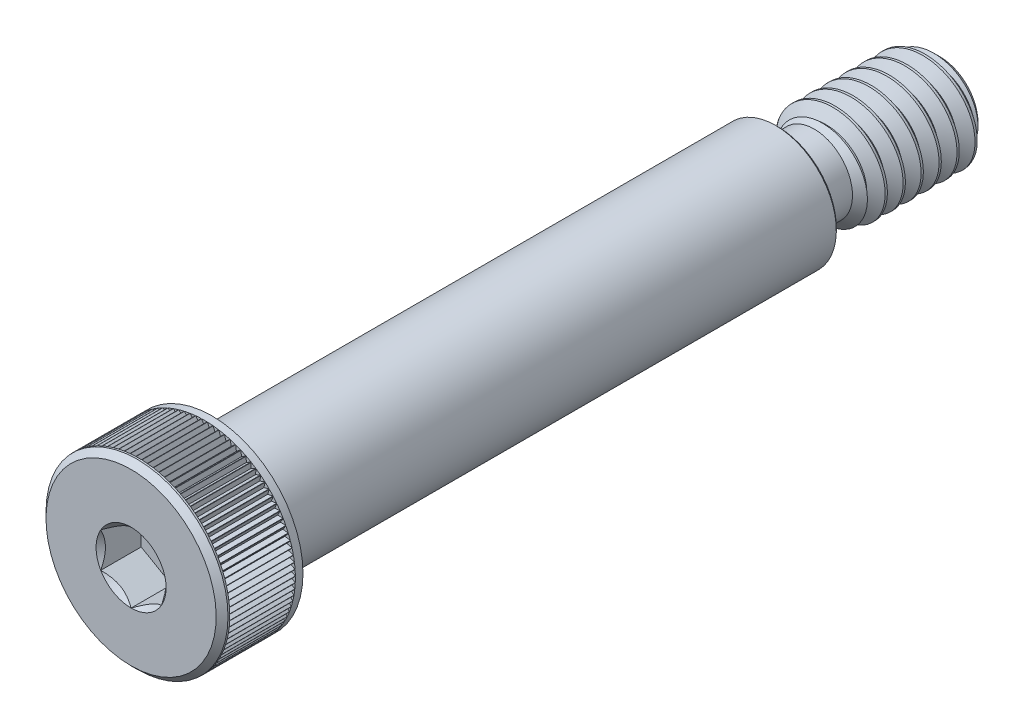
from build123d import *

# Parameters (mm, degrees)
CHAMFER1_SIZE      = 0.993775
CHAMFER2_SIZE      = 0.46434375
CHAMFER3_SIZE      = 0.2032
CUT_EXTRUDE5_DEPTH = 2.575123438
CIRPATTERN1_COUNT  = 99
CUT_EXTRUDE2_DEPTH = 3.175
CUT_SWEEP1_PITCH   = 1.411111111


with BuildPart() as part:
    # Sketch1 → Revolve1 (revolve)
    with BuildSketch(Plane(origin=(0, 0, 0), x_dir=(0, 0, -1), z_dir=(1, 0, 0))):
        Polygon((0, 7.14375), (6.35, 7.14375), (6.35, 4.7625), (50.8, 4.7625), (50.8, 3.9751), (63.5, 3.9751), (63.5, 0), (0, 0), align=None)
    revolve(axis=Axis((0, 0, -63.5), (0, 0, 1)))

    # Sketch5 → Cut-Revolve1 (revolve, cut)
    with BuildSketch(Plane(origin=(0, 0, 0), x_dir=(0, 0, -1), z_dir=(1, 0, 0))):
        with BuildLine():
            Line((50.8, 4.7625), (55.372, 4.7625))
            Line((55.372, 4.7625), (53.6194, 3.0099))
            Line((53.6194, 3.0099), (51.7652, 3.0099))
            ThreePointArc((51.7652, 3.0099), (51.082700535, 3.292600535), (50.8, 3.9751))
            Line((50.8, 3.9751), (50.8, 4.7625))
        make_face()
    revolve(axis=Axis((0, 0, -63.5), (0, 0, 1)), mode=Mode.SUBTRACT)

    # Chamfer1
    chamfer1_edges = [part.edges().sort_by_distance(p)[0] for p in [
        (0, -3.9751, -63.5),
    ]]
    chamfer(chamfer1_edges, length=CHAMFER1_SIZE)

    # Chamfer2
    chamfer2_edges = [part.edges().sort_by_distance(p)[0] for p in [
        (0, -7.14375, 0),
    ]]
    chamfer(chamfer2_edges, length=CHAMFER2_SIZE)

    # Chamfer3
    chamfer3_edges = [part.edges().sort_by_distance(p)[0] for p in [
        (0, -4.7625, -50.8),
    ]]
    chamfer(chamfer3_edges, length=CHAMFER3_SIZE)

    # Sketch11 → Cut-Extrude5 (cut, symmetric)
    with BuildSketch(Plane.XY.offset(-3.175)):
        Polygon((0, 6.772275), (0.214471191, 7.14375), (-0.214471191, 7.14375), align=None)
    cut_extrude5 = extrude(amount=CUT_EXTRUDE5_DEPTH, both=True, mode=Mode.SUBTRACT)

    # CirPattern1: Cut-Extrude5 ×99 about axis
    cirpattern1_axis = Axis((0, 0, 0), (0, 0, 1))
    for i in range(1, CIRPATTERN1_COUNT):
        add(cut_extrude5.rotate(cirpattern1_axis, i * 360 / CIRPATTERN1_COUNT), mode=Mode.SUBTRACT)

    # Sketch8 → Cut-Extrude2 (cut)
    with BuildSketch(Plane.XY):
        Polygon((2.38125, 1.374815329), (0, 2.749630657), (-2.38125, 1.374815329), (-2.38125, -1.374815329), (0, -2.749630657), (2.38125, -1.374815329), align=None)
    extrude(amount=-CUT_EXTRUDE2_DEPTH, mode=Mode.SUBTRACT)

    # Cut-Extrude4 cone 1 section (through the dimple's axis) → Cut-Extrude4 (revolve, cut)
    with BuildSketch(Plane(origin=(0, 0, 0), x_dir=(0, -1, 0), z_dir=(1, 0, 0))):
        Polygon((0, 0), (2.749630657, 0), (0, 2.749630657), align=None)
    revolve(axis=Axis((0, 0, 0), (0, 0, -1)), mode=Mode.SUBTRACT)

    # Cut-Sweep1: the profile of Sketch4 screwed along a right-hand helix of 10 turns, 8 arcs to a turn; built about Z, then put on its axis
    cut_sweep1_z = Axis((0, 0, 0), (0, 0, 1))
    cut_sweep1_corners = [(4.051478629, 0, 0.044097222), (4.051478629, 0, -1.278819444), (3.058556448, 0, -0.705555556), (3.058556448, 0, -0.529166667)]
    with BuildLine(mode=Mode.PRIVATE) as cut_sweep1_profile:
        Line(cut_sweep1_corners[0], cut_sweep1_corners[1])
        Line(cut_sweep1_corners[1], cut_sweep1_corners[2])
        Line(cut_sweep1_corners[2], cut_sweep1_corners[3])
        Line(cut_sweep1_corners[3], cut_sweep1_corners[0])
    cut_sweep1_cap = Face(cut_sweep1_profile.wire())
    cut_sweep1_turn_angles = [0, 22.5, 45, 67.5, 90, 112.5, 135, 157.5, 180, 202.5, 225, 247.5, 270, 292.5, 315, 337.5, 360]
    cut_sweep1_turn_weights = [1, 0.9238795325112867, 1, 0.9238795325112867, 1, 0.9238795325112867, 1, 0.9238795325112867, 1, 0.9238795325112867, 1, 0.9238795325112867, 1, 0.9238795325112867, 1, 0.9238795325112867, 1]
    cut_sweep1_turn_rails = [Edge.make_bspline([Vector(p[0], p[1], 0).rotate(cut_sweep1_z, cut_sweep1_turn_angles[k]) / cut_sweep1_turn_weights[k] + Vector(0, 0, p[2] + CUT_SWEEP1_PITCH * cut_sweep1_turn_angles[k] / 360) for k in range(17)], [0, 0, 0, 1, 1, 2, 2, 3, 3, 4, 4, 5, 5, 6, 6, 7, 7, 8, 8, 8], 2, cut_sweep1_turn_weights) for p in cut_sweep1_corners]
    cut_sweep1_turn_sides = [Face.make_surface_from_curves(cut_sweep1_turn_rails[p[0]], cut_sweep1_turn_rails[p[1]]) for p in [(0, 1), (1, 2), (2, 3), (3, 0)]]
    cut_sweep1 = Plane(origin=(0, 0, -63.5), x_dir=(0, 1, 0), z_dir=(0, 0, 1)) * Solid(Shell([*[p.moved(Location((0, 0, CUT_SWEEP1_PITCH * i))) for i in range(10) for p in cut_sweep1_turn_sides], cut_sweep1_cap, cut_sweep1_cap.rotate(cut_sweep1_z, 3600).moved(Location((0, 0, CUT_SWEEP1_PITCH * 3600 / 360)))]))
    add(cut_sweep1, mode=Mode.SUBTRACT)

    # Sketch12 → Revolve2 (revolve)
    with BuildSketch(Plane(origin=(0, 0, 0), x_dir=(0, 0, -1), z_dir=(1, 0, 0)), mode=Mode.PRIVATE) as revolve2_sk:
        with BuildLine():
            Line((50.8, 4.5593), (50.5968, 4.7625))
            Line((50.5968, 4.7625), (6.35, 4.7625))
            Line((6.35, 4.7625), (6.35, 0))
            Line((6.35, 0), (50.8, 0))
            Line((50.8, 0), (53.6194, 0))
            Line((53.6194, 0), (53.6194, 3.0099))
            Line((53.6194, 3.0099), (51.7652, 3.0099))
            ThreePointArc((51.7652, 3.0099), (51.082700535, 3.292600535), (50.8, 3.9751))
            Line((50.8, 3.9751), (50.8, 4.5593))
        make_face()
    revolve(revolve2_sk.sketch.rotate(Axis((0, 0, -6.35), (0, 0, -1)), 160.226555092), axis=Axis((0, 0, -6.35), (0, 0, -1)))


solid = part.part
